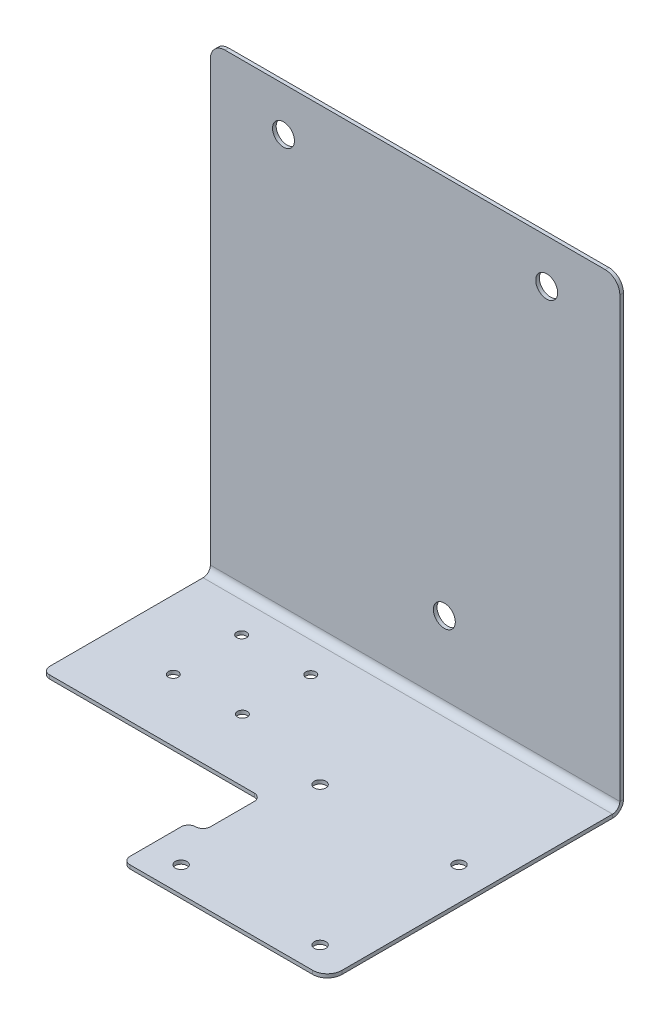
from build123d import *

# Parameters (mm, degrees)
SKETCH2_W               = 177.8
SKETCH2_H               = 203.2
BOSS_EXTRUDE1_DEPTH     = 3.175
SKETCH3_W               = 177.8
SKETCH3_H               = 3.175
BOSS_EXTRUDE2_DEPTH     = 127
FILLET1_R               = 3.175
FILLET2_R               = 6.35
CUT_EXTRUDE1_DEPTH      = 255.673793803
CUT_EXTRUDE1_DEPTH_BACK = 255.673793803
FILLET4_R               = 3.175
SKETCH6_R               = 2.54
SKETCH6_R_2             = 2.15
CUT_EXTRUDE2_DEPTH      = 255.673793803
SKETCH7_R               = 4.7625
CUT_EXTRUDE3_DEPTH      = 186.350397895
CONVERT_SOLID1_START    = -88.9
CONVERT_SOLID1_DEPTH    = 177.8


# Read off the part's stored shape, not the designer's step: Convert-Solid1
with BuildPart() as part:
    # Sketch2 → Boss-Extrude1 (new body)
    with BuildSketch(Plane.XY):
        Rectangle(SKETCH2_W, SKETCH2_H)
    extrude(amount=BOSS_EXTRUDE1_DEPTH)

    # Sketch3 → Boss-Extrude2 (add)
    with BuildSketch(Plane.XY.offset(3.175)):
        with Locations((0, -100.0125)):
            Rectangle(SKETCH3_W, SKETCH3_H)
    extrude(amount=BOSS_EXTRUDE2_DEPTH)

    # Fillet1
    fillet1_edges = [part.edges().sort_by_distance(p)[0] for p in [
        (0, -98.425, 3.175),
        (0, -101.6, 0),
    ]]
    fillet(fillet1_edges, radius=FILLET1_R)

    # Fillet2
    fillet2_edges = [part.edges().sort_by_distance(p)[0] for p in [
        (-88.9, -100.0125, 130.175),
        (88.9, -100.0125, 130.175),
        (-88.9, 101.6, 1.5875),
        (88.9, 101.6, 1.5875),
    ]]
    fillet(fillet2_edges, radius=FILLET2_R)

    # Sketch5 → Cut-Extrude1 (cut, two sides: drawn at the far end of the back side and taken through both)
    with BuildSketch(Plane(origin=(0, -98.425, 0), x_dir=(1, 0, 0), z_dir=(0, 1, 0)).offset(-CUT_EXTRUDE1_DEPTH_BACK)):
        Polygon((-485.781273778, -76.2), (-88.9, -76.2), (6.35, -76.2), (6.35, -101.6), (0, -101.6), (0, -130.175), (0, -527.056273778), (-539.971017798, -1108.855450333), (-1025.752291576, -657.999176556), align=None)
    extrude(amount=CUT_EXTRUDE1_DEPTH + CUT_EXTRUDE1_DEPTH_BACK, mode=Mode.SUBTRACT)

    # Fillet4
    fillet4_edges = [part.edges().sort_by_distance(p)[0] for p in [
        (6.35, -100.0125, 101.6),
        (-88.9, -100.0125, 76.2),
        (0, -100.0125, 130.175),
        (0, -100.0125, 101.6),
        (6.35, -100.0125, 76.2),
    ]]
    fillet(fillet4_edges, radius=FILLET4_R - 0.0001)  # a hair under: the kernel refuses the full size

    # Sketch6 → Cut-Extrude2 (cut, through all)
    with BuildSketch(Plane(origin=(0, -98.425, 0), x_dir=(1, 0, 0), z_dir=(0, 1, 0))):
        with Locations(Location((74.6125, -119.0625, 0), (0, 0, 270))):
            Circle(SKETCH6_R)
        with Locations(Location((14.2875, -119.0625, 0), (0, 0, 270))):
            Circle(SKETCH6_R)
        with Locations(Location((14.2875, -58.7375, 0), (0, 0, 270))):
            Circle(SKETCH6_R)
        with Locations(Location((74.6125, -58.7375, 0), (0, 0, 270))):
            Circle(SKETCH6_R)
        with Locations(Location((-29.05, -49.140037229, 0), (0, 0, 270))):
            Circle(SKETCH6_R_2)
        with Locations(Location((-59.05, -49.140037229, 0), (0, 0, 270))):
            Circle(SKETCH6_R_2)
        with Locations(Location((-29.05, -19.440037229, 0), (0, 0, 270))):
            Circle(SKETCH6_R_2)
        with Locations(Location((-59.05, -19.440037229, 0), (0, 0, 270))):
            Circle(SKETCH6_R_2)
    extrude(amount=-CUT_EXTRUDE2_DEPTH, mode=Mode.SUBTRACT)

    # Sketch7 → Cut-Extrude3 (cut, through all)
    with BuildSketch(Plane.XY.offset(3.175)):
        with Locations((-57.15, 82.55)):
            Circle(SKETCH7_R)
        with Locations((57.15, 82.55)):
            Circle(SKETCH7_R)
        with Locations((12.7, -63.5)):
            Circle(SKETCH7_R)
    extrude(amount=-CUT_EXTRUDE3_DEPTH, mode=Mode.SUBTRACT)

    # Convert-Solid1 outline → Convert-Solid1 (cut)
    with BuildSketch(Plane.YZ.offset(CONVERT_SOLID1_START)):
        with BuildLine():
            ThreePointArc((-95.25, 1.5875), (-98.617596045, 2.982403955), (-100.0125, 6.35))
            Line((-100.0125, 6.35), (-100.0125, 130.175))
            Line((-100.0125, 130.175), (-101.6, 130.175))
            Line((-101.6, 130.175), (-101.6, 3.175))
            ThreePointArc((-101.6, 3.175), (-100.67006403, 0.92993597), (-98.425, 0))
            Line((-98.425, 0), (101.6, 0))
            Line((101.6, 0), (101.6, 1.5875))
            Line((101.6, 1.5875), (-95.25, 1.5875))
        make_face()
    extrude(amount=CONVERT_SOLID1_DEPTH, mode=Mode.SUBTRACT)


solid = part.part
